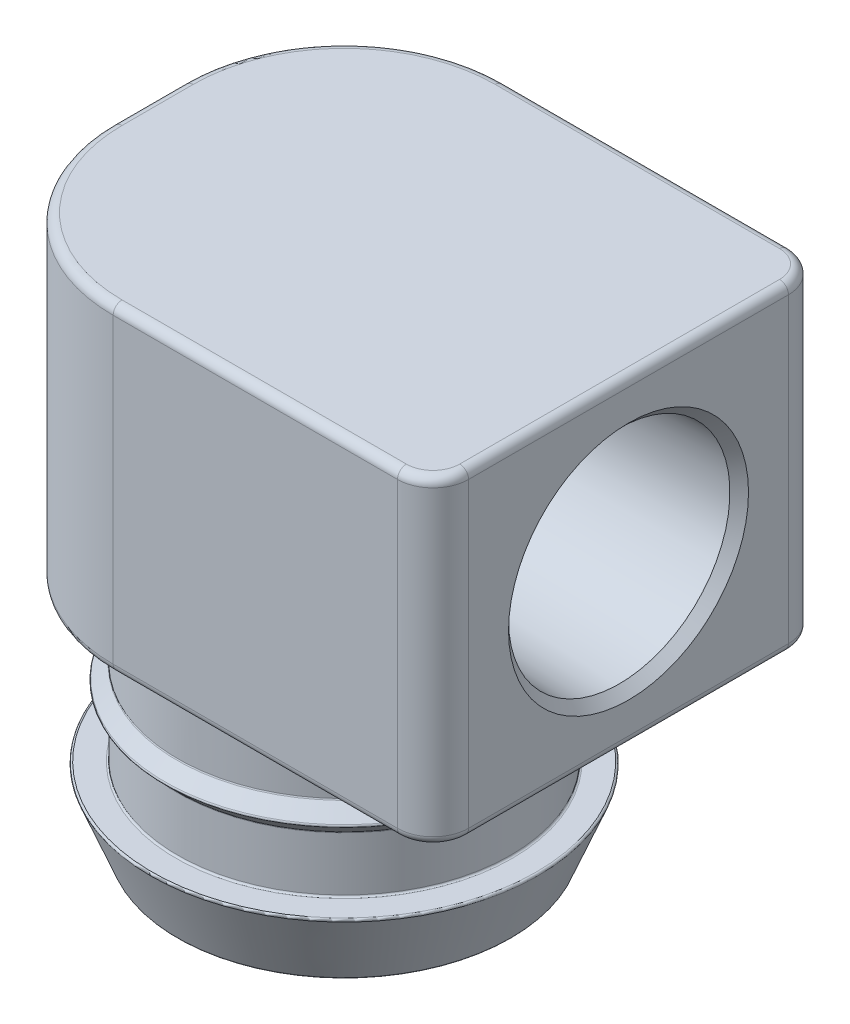
from build123d import *

# Parameters (mm, degrees)
BOSS_EXTRUDE1_DEPTH = 11
SKETCH3_R           = 6
CUT_EXTRUDE1_DEPTH  = 28.5
FILLET3_R           = 0.1
CHAMFER1_SIZE       = 0.508
CHAMFER1_SIZE2      = 0.523914353
FILLET6_R           = 9
FILLET9_R           = 2
FILLET8_R           = 0.5


# Read off the part's stored shape, not the designer's step: 1/4 NPT Tapped Hole1
with BuildPart() as part:
    # Sketch1 → Boss-Extrude1 (new, symmetric)
    with BuildSketch(Plane.XY):
        Polygon((-11, 0), (0, 0), (16, 0), (16, -18), (-11, -18), align=None)
    extrude(amount=BOSS_EXTRUDE1_DEPTH, both=True)

    # Sketch2 → Revolve1 (revolve)
    with BuildSketch(Plane.XY, mode=Mode.PRIVATE) as revolve1_sk:
        Polygon((0, -18), (9.365, -18), (9.365, -21.96875), (10.15875, -22.7625), (9.365, -23.55625), (9.365, -26.73125), (10.9525, -26.73125), (9.365, -30.7), (0, -30.7), align=None)
    revolve(revolve1_sk.sketch.rotate(Axis((0, 9.54404991, 0), (0, -1, 0)), 180), axis=Axis((0, 9.54404991, 0), (0, -1, 0)))

    # Sketch3 → Cut-Extrude1 (cut)
    with BuildSketch(Plane.XZ.offset(30.7)):
        Circle(SKETCH3_R)
    extrude(amount=-CUT_EXTRUDE1_DEPTH, mode=Mode.SUBTRACT)

    # 1/4 NPT Tapped Hole1 outline → 1/4 NPT Tapped Hole1 (revolve, cut)
    with BuildSketch(Plane(origin=(0, -9, 0), x_dir=(0, 1, 0), z_dir=(0, 0, -1))):
        Polygon((0, 2.247860366), (5.5626, 2.247860366), (5.5626, 5.98), (5.943676082, 5.98), (6.2436883, 16), (0, 16), align=None)
    revolve(axis=Axis((0, -9, 0), (1, 0, 0)), mode=Mode.SUBTRACT)

    # Fillet3
    fillet3_edges = [part.edges().sort_by_distance(p)[0] for p in [
        (9.365, -18, 0),
        (9.365, -21.96875, 0),
        (10.15875, -22.7625, 0),
        (9.365, -23.55625, 0),
        (9.365, -26.73125, 0),
        (10.9525, -26.73125, 0),
        (9.365, -30.7, 0),
        (-6, -2.2, 0),
        (2.248884443, -9.000000001, -5.5626),
        (2.248884443, -8.999999999, 5.5626),
    ]]
    fillet(fillet3_edges, radius=FILLET3_R)

    # Chamfer1
    chamfer1_edges = [part.edges().sort_by_distance(p)[0] for p in [
        (16, -15.2436883, 0),
    ]]
    chamfer1_side = [part.faces().sort_by_distance(p)[0] for p in [
        (16, -9, -10.715746592),
    ]]
    chamfer(chamfer1_edges, length=CHAMFER1_SIZE, length2=CHAMFER1_SIZE2, reference=chamfer1_side[0])

    # Fillet6
    fillet6_edges = [part.edges().sort_by_distance(p)[0] for p in [
        (-11, -9, 11),
        (-11, -9, -11),
    ]]
    fillet(fillet6_edges, radius=FILLET6_R)

    # Fillet9
    fillet9_edges = [part.edges().sort_by_distance(p)[0] for p in [
        (16, -9, 11),
        (16, -9, -11),
    ]]
    fillet(fillet9_edges, radius=FILLET9_R)

    # Fillet8
    fillet8_edges = [part.edges().sort_by_distance(p)[0] for p in [
        (-8.363961031, 0, -8.363961031),
        (16, 0, 0),
        (16, -18, 0),
        (6, 0, -11),
        (6, 0, 11),
        (15.414213562, 0, 10.414213562),
        (15.414213562, 0, -10.414213562),
        (15.414213562, -18, 10.414213562),
        (15.414213562, -18, -10.414213562),
        (-6, -30.7, 0),
        (-11, -18, 0),
        (-11, 0, 0),
        (6, -18, -11),
        (6, -18, 11),
        (-8.363961031, -18, 8.363961031),
        (-8.363961031, -18, -8.363961031),
        (-8.363961031, 0, 8.363961031),
    ]]
    fillet(fillet8_edges, radius=FILLET8_R)


solid = part.part
